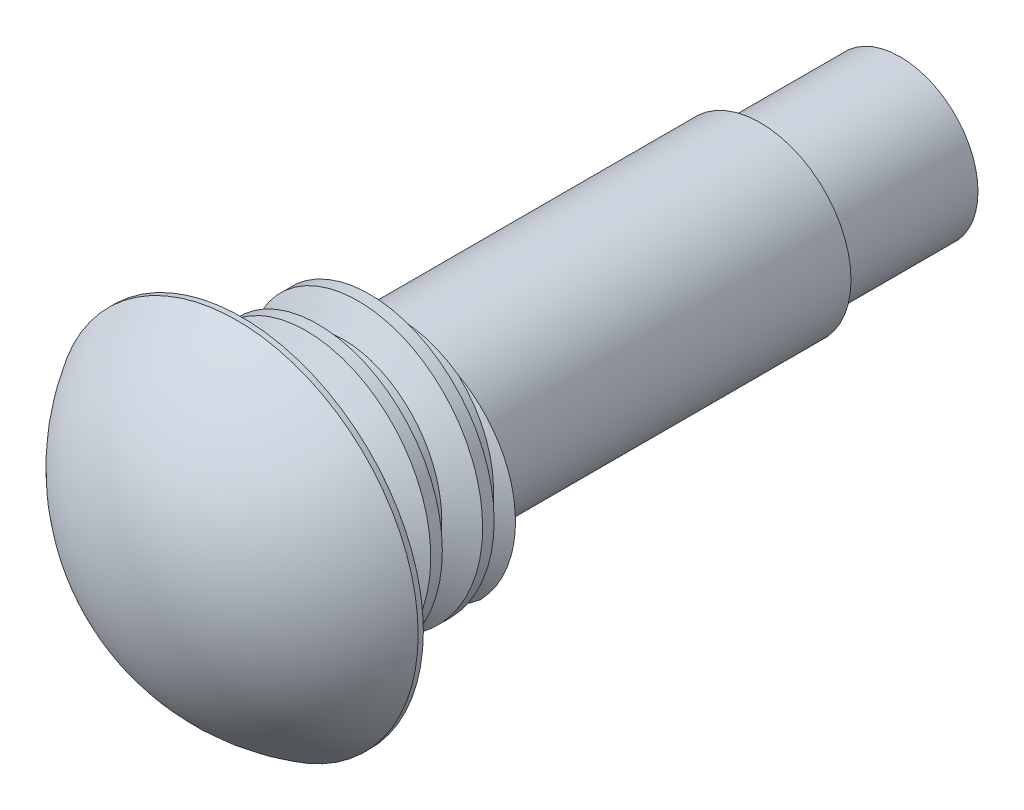
from build123d import *

# Parameters (mm, degrees)
SKETCH3_R           = 3.175
BOSS_EXTRUDE1_DEPTH = 3.81
CUT_SWEEP1_PITCH    = 1.27
SKETCH8_R           = 2.2225
BOSS_EXTRUDE3_DEPTH = 8.89
SKETCH10_R          = 1.905
BOSS_EXTRUDE5_DEPTH = 3.429
SKETCH11_R          = 4.445
BOSS_EXTRUDE6_DEPTH = 0.127
DOME1_FACE_RADIUS   = 4.445
DOME1_HEIGHT        = 2.54


with BuildPart() as part:
    # Sketch3 → Boss-Extrude1 (new body)
    with BuildSketch(Plane.XY):
        with Locations(Location((0, 0, 0), (0, 0, 180))):
            Circle(SKETCH3_R)
    extrude(amount=BOSS_EXTRUDE1_DEPTH)

    # Cut-Sweep1: arcs per turn and ends read off the stored shape
    # Cut-Sweep1: the profile of Sketch5 profile screwed along a left-hand helix through 3.599997 turns, 8 arcs to a turn; built about Z, then put on its axis
    cut_sweep1_z = Axis((0, 0, 0), (0, 0, 1))
    cut_sweep1_corners = [(2.54, 0, -1.397), (3.1753, 0, -1.763790626), (3.1753, 0, -0.776209374), (2.54, 0, -1.143)]
    with BuildLine(mode=Mode.PRIVATE) as cut_sweep1_profile:
        Line(cut_sweep1_corners[0], cut_sweep1_corners[1])
        Line(cut_sweep1_corners[1], cut_sweep1_corners[2])
        Line(cut_sweep1_corners[2], cut_sweep1_corners[3])
        Line(cut_sweep1_corners[3], cut_sweep1_corners[0])
    cut_sweep1_cap = Face(cut_sweep1_profile.wire())
    cut_sweep1_turn_angles = [0, -22.5, -45, -67.5, -90, -112.5, -135, -157.5, -180, -202.5, -225, -247.5, -270, -292.5, -315, -337.5, -360]
    cut_sweep1_turn_weights = [1, 0.9238795325112867, 1, 0.9238795325112867, 1, 0.9238795325112867, 1, 0.9238795325112867, 1, 0.9238795325112867, 1, 0.9238795325112867, 1, 0.9238795325112867, 1, 0.9238795325112867, 1]
    cut_sweep1_turn_rails = [Edge.make_bspline([Vector(p[0], p[1], 0).rotate(cut_sweep1_z, cut_sweep1_turn_angles[k]) / cut_sweep1_turn_weights[k] + Vector(0, 0, p[2] + -CUT_SWEEP1_PITCH * cut_sweep1_turn_angles[k] / 360) for k in range(17)], [0, 0, 0, 1, 1, 2, 2, 3, 3, 4, 4, 5, 5, 6, 6, 7, 7, 8, 8, 8], 2, cut_sweep1_turn_weights) for p in cut_sweep1_corners]
    cut_sweep1_turn_sides = [Face.make_surface_from_curves(cut_sweep1_turn_rails[p[0]], cut_sweep1_turn_rails[p[1]]) for p in [(0, 1), (1, 2), (2, 3), (3, 0)]]
    cut_sweep1_last_angles = [-1080, -1102.5, -1125, -1147.5, -1170, -1192.5, -1215, -1237.5, -1260, -1277.9995, -1295.999]
    cut_sweep1_last_weights = [1, 0.9238795325112867, 1, 0.9238795325112867, 1, 0.9238795325112867, 1, 0.9238795325112867, 1, 0.9510592129409382, 1]
    cut_sweep1_last_rails = [Edge.make_bspline([Vector(p[0], p[1], 0).rotate(cut_sweep1_z, cut_sweep1_last_angles[k]) / cut_sweep1_last_weights[k] + Vector(0, 0, p[2] + -CUT_SWEEP1_PITCH * cut_sweep1_last_angles[k] / 360) for k in range(11)], [0, 0, 0, 1, 1, 2, 2, 3, 3, 4, 4, 5, 5, 5], 2, cut_sweep1_last_weights) for p in cut_sweep1_corners]
    cut_sweep1_last_sides = [Face.make_surface_from_curves(cut_sweep1_last_rails[p[0]], cut_sweep1_last_rails[p[1]]) for p in [(0, 1), (1, 2), (2, 3), (3, 0)]]
    cut_sweep1 = Plane(origin=(0, 0, 0), x_dir=(0, 1, 0), z_dir=(0, 0, 1)) * Solid(Shell([*[p.moved(Location((0, 0, CUT_SWEEP1_PITCH * i))) for i in range(3) for p in cut_sweep1_turn_sides], *cut_sweep1_last_sides, cut_sweep1_cap, cut_sweep1_cap.rotate(cut_sweep1_z, -1295.999).moved(Location((0, 0, -CUT_SWEEP1_PITCH * -1295.999 / 360)))]))
    add(cut_sweep1, mode=Mode.SUBTRACT)

    # Sketch8 → Boss-Extrude3 (add)
    with BuildSketch(Plane.XY):
        Circle(SKETCH8_R)
    extrude(amount=-BOSS_EXTRUDE3_DEPTH)

    # Sketch10 → Boss-Extrude5 (add)
    with BuildSketch(Plane(origin=(0, 0, -8.89), x_dir=(-1, 0, 0), z_dir=(0, 0, -1))):
        with Locations(Location((0, 0, 0), (0, 0, 180))):
            Circle(SKETCH10_R)
    extrude(amount=BOSS_EXTRUDE5_DEPTH)

    # Sketch11 → Boss-Extrude6 (add)
    with BuildSketch(Plane.XY.offset(3.81)):
        Circle(SKETCH11_R)
    extrude(amount=BOSS_EXTRUDE6_DEPTH)

    # Dome1: a dome of height H over a round flat face of radius A is a cap of a sphere of radius (A * A + H * H) / (2 * H)
    dome1_r = (DOME1_FACE_RADIUS * DOME1_FACE_RADIUS + DOME1_HEIGHT * DOME1_HEIGHT) / (2 * DOME1_HEIGHT)
    dome1_base = Plane((0, 0, 3.937), z_dir=(0, 0, 1))
    with Locations(dome1_base.offset(DOME1_HEIGHT - dome1_r)):
        dome1_ball = Sphere(dome1_r, mode=Mode.PRIVATE)
    add(split(dome1_ball, bisect_by=dome1_base, keep=Keep.TOP, mode=Mode.PRIVATE))


solid = part.part
